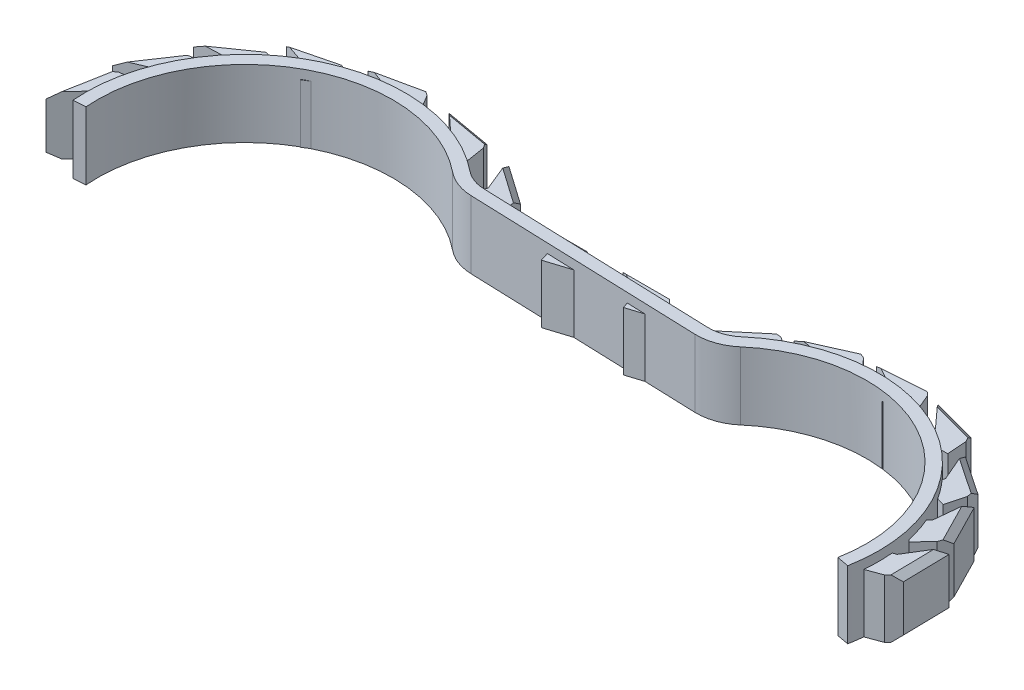
from build123d import *
from OCP.BRepFilletAPI import BRepFilletAPI_MakeChamfer

# Parameters (mm, degrees)
EXTRUDE_2_DEPTH   = 11
EXTRUDE_3_DEPTH   = 9.5
CHAMFER_1_SIZE    = 1
CHAMFER_1_SIZE2   = 1.61712281
CHAMFER_1_SIZE2_2 = 1.617122809
CHAMFER_1_SIZE2_3 = 1.617122811
CHAMFER_1_SIZE2_4 = 0.723405284


# Read off the part's stored shape, not the designer's step: 凸台-拉伸3
with BuildPart() as part:
    # 草图2 → 凸台-拉伸2 (new body)
    with BuildSketch(Plane(origin=(0, 0, 0), x_dir=(1, 0, 0), z_dir=(0, 1, 0))):
        with BuildLine():
            Line((-19.132296049, 16.866454117), (18.555519142, 15.54984922))
            ThreePointArc((18.555519142, 15.54984922), (21.477472764, 15.994050776), (24.038740937, 17.468850199))
            ThreePointArc((24.038740937, 17.468850199), (50.512289767, 19.91148373), (61.603868982, -4.250306699))
            Line((61.603868982, -4.250306699), (63.569422807, -4.619898586))
            ThreePointArc((63.569422807, -4.619898586), (51.513358442, 21.642917098), (22.737761888, 18.987880651))
            ThreePointArc((22.737761888, 18.987880651), (20.816810758, 17.881781084), (18.625345542, 17.548629916))
            Line((18.625345542, 17.548629916), (-19.062469649, 18.865234814))
            ThreePointArc((-19.062469649, 18.865234814), (-20.955262867, 19.241928278), (-22.63055474, 20.200031235))
            ThreePointArc((-22.63055474, 20.200031235), (-51.116752852, 23.00400618), (-64.9171999, -2.073342558))
            Line((-64.9171999, -2.073342558), (-62.923569138, -1.913854668))
            ThreePointArc((-62.923569138, -1.913854668), (-50.184694941, 21.234467243), (-23.889742837, 18.646182678))
            ThreePointArc((-23.889742837, 18.646182678), (-21.65602034, 17.36871207), (-19.132296049, 16.866454117))
        make_face()
    extrude(amount=EXTRUDE_2_DEPTH)

    # 凸台-拉伸3 outline → 凸台-拉伸3 (add)
    with BuildSketch(Plane(origin=(0, 0, 0), x_dir=(1, 0, 0), z_dir=(0, 1, 0))):
        Polygon((1.509952661, 20.901115598), (6.026508067, 17.988763977), (11.160061895, 17.809425851), (10.091240619, 20.901115598), align=None)
        Polygon((-11.808829957, 20.901115598), (-8.055183791, 18.48070081), (-2.321539759, 18.280398835), (-3.227541999, 20.901115598), align=None)
        with BuildLine():
            Line((-20.309179364, 20.842254555), (-20.827615105, 19.195815043))
            ThreePointArc((-20.827615105, 19.195815043), (-19.957480483, 18.964111197), (-19.062469649, 18.865234814))
            Line((-19.062469649, 18.865234814), (-16.410904709, 18.772603724))
            Line((-16.410904709, 18.772603724), (-15.601854188, 21.616913619))
            Line((-15.601854188, 21.616913619), (-22.635627666, 26.53265707))
            Line((-22.635627666, 26.53265707), (-20.309179364, 20.842254555))
        make_face()
        with BuildLine():
            Line((-30.523410649, 24.995562107), (-30.465831271, 24.559478091))
            ThreePointArc((-30.465831271, 24.559478091), (-28.454718543, 23.765458948), (-26.516534249, 22.80708405))
            Line((-26.516534249, 22.80708405), (-25.81581444, 22.899605236))
            Line((-25.81581444, 22.899605236), (-26.584510252, 27.687043232))
            Line((-26.584510252, 27.687043232), (-35.03675688, 29.16961868))
            Line((-35.03675688, 29.16961868), (-30.523410649, 24.995562107))
        make_face()
        with BuildLine():
            Line((-41.793508963, 26.321666613), (-41.540883568, 25.875546578))
            ThreePointArc((-41.540883568, 25.875546578), (-39.284746718, 25.998440709), (-37.026459417, 25.924990599))
            Line((-37.026459417, 25.924990599), (-36.643542501, 26.141825822))
            Line((-36.643542501, 26.141825822), (-39.149670686, 30.292702517))
            Line((-39.149670686, 30.292702517), (-47.541839832, 28.50105522))
            Line((-47.541839832, 28.50105522), (-41.793508963, 26.321666613))
        make_face()
        with BuildLine():
            Line((-52.189835936, 23.12143196), (-51.866030655, 22.593478156))
            ThreePointArc((-51.866030655, 22.593478156), (-49.917761837, 23.596662401), (-47.891936049, 24.43222203))
            Line((-47.891936049, 24.43222203), (-49.686195367, 27.182317441))
            Line((-49.686195367, 27.182317441), (-58.010724642, 25.098879088))
            Line((-58.010724642, 25.098879088), (-52.189835936, 23.12143196))
        make_face()
        with BuildLine():
            Line((-58.959787889, 17.986467336), (-58.268464034, 17.456411252))
            ThreePointArc((-58.268464034, 17.456411252), (-56.713457183, 19.032431128), (-55.030004578, 20.470440963))
            Line((-55.030004578, 20.470440963), (-58.077729263, 22.674855072))
            Line((-58.077729263, 22.674855072), (-65.102709323, 17.746553319))
            Line((-65.102709323, 17.746553319), (-58.959787889, 17.986467336))
        make_face()
        with BuildLine():
            Line((-63.407040272, 10.936733793), (-62.685647299, 10.723344256))
            ThreePointArc((-62.685647299, 10.723344256), (-61.674250421, 12.723143001), (-60.494402691, 14.628419359))
            Line((-60.494402691, 14.628419359), (-64.263735503, 15.629822357))
            Line((-64.263735503, 15.629822357), (-69.05597399, 8.511328604))
            Line((-69.05597399, 8.511328604), (-63.407040272, 10.936733793))
        make_face()
        with BuildLine():
            Line((-63.887137271, 7.525317167), (-68.217697297, 6.866685493))
            Line((-68.217697297, 6.866685493), (-69.770152334, -1.573005638))
            Line((-69.770152334, -1.573005638), (-65.558897097, 2.905651728))
            Line((-65.558897097, 2.905651728), (-64.826788776, 2.99616113))
            ThreePointArc((-64.826788776, 2.99616113), (-64.457884582, 5.281677066), (-63.887137271, 7.525317167))
        make_face()
        with BuildLine():
            ThreePointArc((23.160852709, 19.342218412), (25.089391993, 20.772457363), (27.146239325, 22.011096244))
            Line((27.146239325, 22.011096244), (23.021620513, 24.477494022))
            Line((23.021620513, 24.477494022), (16.452902423, 18.95567859))
            Line((16.452902423, 18.95567859), (22.551538301, 19.730070542))
            Line((22.551538301, 19.730070542), (23.160852709, 19.342218412))
        make_face()
        with BuildLine():
            ThreePointArc((31.500549491, 23.848652836), (33.693739523, 24.430382719), (35.930640341, 24.810865186))
            Line((35.930640341, 24.810865186), (36.25860383, 25.101244014))
            Line((36.25860383, 25.101244014), (32.944224768, 28.640360746))
            Line((32.944224768, 28.640360746), (25.107949071, 25.143035164))
            Line((25.107949071, 25.143035164), (31.183785489, 24.206416618))
            Line((31.183785489, 24.206416618), (31.500549491, 23.848652836))
        make_face()
        with BuildLine():
            ThreePointArc((40.920211914, 24.926146638), (43.138890272, 24.655011404), (45.324483678, 24.186791979))
            Line((45.324483678, 24.186791979), (45.851728195, 24.394709543))
            Line((45.851728195, 24.394709543), (43.947679859, 28.853975822))
            Line((43.947679859, 28.853975822), (35.387833615, 28.247728917))
            Line((35.387833615, 28.247728917), (40.776909853, 25.289536938))
            Line((40.776909853, 25.289536938), (40.920211914, 24.926146638))
        make_face()
        with BuildLine():
            ThreePointArc((49.954548309, 22.472157692), (51.492067719, 21.655212862), (52.968998307, 20.733236272))
            Line((52.968998307, 20.733236272), (54.425289614, 20.797371264))
            Line((54.425289614, 20.797371264), (54.076771637, 25.633587868))
            Line((54.076771637, 25.633587868), (45.785903323, 27.847183501))
            Line((45.785903323, 27.847183501), (49.918281908, 23.295646431))
            Line((49.918281908, 23.295646431), (49.954548309, 22.472157692))
        make_face()
        with BuildLine():
            ThreePointArc((57.639521218, 16.66037961), (58.857493933, 15.188151129), (59.959469836, 13.627201628))
            Line((59.959469836, 13.627201628), (61.213454471, 13.256270373))
            Line((61.213454471, 13.256270373), (62.458442363, 17.942469362))
            Line((62.458442363, 17.942469362), (55.33994861, 22.734707848))
            Line((55.33994861, 22.734707848), (57.7653538, 17.085774131))
            Line((57.7653538, 17.085774131), (57.639521218, 16.66037961))
        make_face()
        with BuildLine():
            ThreePointArc((62.026011142, 9.736673503), (62.792944972, 7.674357926), (63.375575489, 5.552595752))
            Line((63.375575489, 5.552595752), (63.700399481, 5.222302472))
            Line((63.700399481, 5.222302472), (67.061204779, 8.717362352))
            Line((67.061204779, 8.717362352), (63.158553178, 16.359862826))
            Line((63.158553178, 16.359862826), (62.541202944, 10.243334304))
            Line((62.541202944, 10.243334304), (62.026011142, 9.736673503))
        make_face()
        with BuildLine():
            Line((67.721327754, 7.712051308), (64.485147416, 2.485180418))
            Line((64.485147416, 2.485180418), (63.89512565, 2.287513687))
            ThreePointArc((63.89512565, 2.287513687), (63.999991439, -0.020689822), (63.89130529, -2.328716596))
            Line((63.89130529, -2.328716596), (67.87875608, -0.867792475))
            Line((67.87875608, -0.867792475), (67.721327754, 7.712051308))
        make_face()
        with BuildLine():
            Line((32.969747867, 22.189291407), (32.979707703, 22.198109845))
            ThreePointArc((32.979707703, 22.198109845), (32.972545507, 22.196166163), (32.965383939, 22.194220171))
            Line((32.965383939, 22.194220171), (32.969747867, 22.189291407))
        make_face()
        with BuildLine():
            Line((41.765268067, 22.783224154), (41.86174794, 22.821270752))
            ThreePointArc((41.86174794, 22.821270752), (41.803178905, 22.828538894), (41.744591413, 22.835656723))
            Line((41.744591413, 22.835656723), (41.765268067, 22.783224154))
        make_face()
        with BuildLine():
            Line((61.941943413, 1.633166388), (61.930542774, 1.629346991))
            Line((61.930542774, 1.629346991), (61.945301076, 1.585294462))
            ThreePointArc((61.945301076, 1.585294462), (61.94363473, 1.609231301), (61.941943413, 1.633166388))
        make_face()
        Polygon((-5.833384373, 14.999714699), (-1.823432409, 16.261777658), (-6.279592447, 16.417451371), align=None)
        Polygon((7.485398244, 14.999714699), (10.164699231, 15.842978299), (7.187258581, 15.946993694), align=None)
        with BuildLine():
            Line((-50.781276456, 20.824822301), (-49.745719627, 21.459951298))
            ThreePointArc((-49.745719627, 21.459951298), (-50.286383316, 21.180593752), (-50.819790058, 20.887617456))
            Line((-50.819790058, 20.887617456), (-50.781276456, 20.824822301))
        make_face()
    extrude(amount=EXTRUDE_3_DEPTH)

    # 倒角1: one chamfer whose edges measure the first distance from different faces: ONE call of the kernel's chamfer builder (chamfer() names one face for all edges)
    chamfer_1_edges_1 = [part.edges().sort_by_distance(p)[0] for p in [
        (-30.810633566, 0, -28.428330956),
        (-30.810633566, 9.5, -28.428330956),
        (67.800041917, 0, -3.422129417),
        (67.800041917, 9.5, -3.422129417),
        (65.109878978, 0, -12.538612589),
        (65.109878978, 9.5, -12.538612589),
        (58.899195487, 0, -20.338588605),
        (58.899195487, 9.5, -20.338588605),
        (49.93133748, 0, -26.740385684),
        (49.93133748, 9.5, -26.740385684),
        (39.667756737, 9.5, -28.550852369),
        (39.667756737, 0, -28.550852369),
        (29.026086919, 9.5, -26.891697955),
        (29.026086919, 0, -26.891697955),
        (19.737261468, 0, -21.716586306),
        (19.737261468, 9.5, -21.716586306),
        (5.80059664, 9.5, -20.901115598),
        (5.80059664, 0, -20.901115598),
        (-7.518185978, 9.5, -20.901115598),
        (-7.518185978, 0, -20.901115598),
        (-19.118740927, 9.5, -24.074785345),
        (-19.118740927, 0, -24.074785345),
        (-53.848460004, 9.5, -26.140598264),
        (-53.848460004, 0, -26.140598264),
        (-68.993924816, 0, -2.646839928),
        (-68.993924816, 9.5, -2.646839928),
        (-66.659854747, 0, -12.070575481),
        (-66.659854747, 9.5, -12.070575481),
        (-61.590219293, 0, -20.210704195),
        (-61.590219293, 9.5, -20.210704195),
        (-43.345755259, 0, -29.396878868),
        (-43.345755259, 9.5, -29.396878868),
    ]]
    chamfer_1_edges_2 = [part.edges().sort_by_distance(p)[0] for p in [
        (-26.584510252, 4.75, -27.687043232),
    ]]
    chamfer_1_side_2 = [part.faces().sort_by_distance(p)[0] for p in [
        (-30.810633566, 4.75, -28.428330956),
    ]]
    chamfer_1_edges_3 = [part.edges().sort_by_distance(p)[0] for p in [
        (67.87875608, 4.75, 0.867792475),
    ]]
    chamfer_1_side_3 = [part.faces().sort_by_distance(p)[0] for p in [
        (67.800041917, 4.75, -3.422129417),
    ]]
    chamfer_1_edges_4 = [part.edges().sort_by_distance(p)[0] for p in [
        (67.061204779, 4.75, -8.717362352),
    ]]
    chamfer_1_side_4 = [part.faces().sort_by_distance(p)[0] for p in [
        (65.109878978, 4.75, -12.538612589),
    ]]
    chamfer_1_edges_5 = [part.edges().sort_by_distance(p)[0] for p in [
        (62.458442363, 4.75, -17.942469362),
    ]]
    chamfer_1_side_5 = [part.faces().sort_by_distance(p)[0] for p in [
        (58.899195486, 4.75, -20.338588605),
    ]]
    chamfer_1_edges_6 = [part.edges().sort_by_distance(p)[0] for p in [
        (54.076771637, 4.75, -25.633587868),
    ]]
    chamfer_1_side_6 = [part.faces().sort_by_distance(p)[0] for p in [
        (49.93133748, 4.75, -26.740385685),
    ]]
    chamfer_1_edges_7 = [part.edges().sort_by_distance(p)[0] for p in [
        (43.947679859, 4.75, -28.853975822),
    ]]
    chamfer_1_side_7 = [part.faces().sort_by_distance(p)[0] for p in [
        (39.667756737, 4.75, -28.550852369),
    ]]
    chamfer_1_edges_8 = [part.edges().sort_by_distance(p)[0] for p in [
        (32.944224768, 4.75, -28.640360746),
    ]]
    chamfer_1_side_8 = [part.faces().sort_by_distance(p)[0] for p in [
        (29.026086919, 4.75, -26.891697955),
    ]]
    chamfer_1_edges_9 = [part.edges().sort_by_distance(p)[0] for p in [
        (23.021620513, 4.75, -24.477494022),
    ]]
    chamfer_1_side_9 = [part.faces().sort_by_distance(p)[0] for p in [
        (19.737261468, 4.75, -21.716586306),
    ]]
    chamfer_1_edges_10 = [part.edges().sort_by_distance(p)[0] for p in [
        (10.091240619, 4.75, -20.901115598),
    ]]
    chamfer_1_side_10 = [part.faces().sort_by_distance(p)[0] for p in [
        (5.80059664, 4.75, -20.901115598),
    ]]
    chamfer_1_edges_11 = [part.edges().sort_by_distance(p)[0] for p in [
        (-3.227541999, 4.75, -20.901115598),
    ]]
    chamfer_1_side_11 = [part.faces().sort_by_distance(p)[0] for p in [
        (-7.518185978, 4.75, -20.901115598),
    ]]
    chamfer_1_edges_12 = [part.edges().sort_by_distance(p)[0] for p in [
        (-15.601854188, 4.75, -21.616913619),
    ]]
    chamfer_1_side_12 = [part.faces().sort_by_distance(p)[0] for p in [
        (-19.118740927, 4.75, -24.074785345),
    ]]
    chamfer_1_edges_13 = [part.edges().sort_by_distance(p)[0] for p in [
        (-49.686195367, 4.75, -27.182317441),
    ]]
    chamfer_1_side_13 = [part.faces().sort_by_distance(p)[0] for p in [
        (-53.848460005, 4.75, -26.140598264),
    ]]
    chamfer_1_edges_14 = [part.edges().sort_by_distance(p)[0] for p in [
        (-58.010724642, 4.75, -25.098879088),
    ]]
    chamfer_1_side_14 = [part.faces().sort_by_distance(p)[0] for p in [
        (-55.100280289, 4.75, -24.110155524),
    ]]
    chamfer_1_edges_15 = [part.edges().sort_by_distance(p)[0] for p in [
        (-68.217697297, 4.75, -6.866685493),
    ]]
    chamfer_1_side_15 = [part.faces().sort_by_distance(p)[0] for p in [
        (-68.993924816, 4.75, -2.646839927),
    ]]
    chamfer_1_edges_16 = [part.edges().sort_by_distance(p)[0] for p in [
        (-64.263735503, 4.75, -15.629822357),
    ]]
    chamfer_1_side_16 = [part.faces().sort_by_distance(p)[0] for p in [
        (-66.659854747, 4.75, -12.07057548),
    ]]
    chamfer_1_edges_17 = [part.edges().sort_by_distance(p)[0] for p in [
        (-58.077729263, 4.75, -22.674855072),
    ]]
    chamfer_1_side_17 = [part.faces().sort_by_distance(p)[0] for p in [
        (-61.590219293, 4.75, -20.210704195),
    ]]
    chamfer_1_edges_18 = [part.edges().sort_by_distance(p)[0] for p in [
        (-39.149670686, 4.75, -30.292702517),
    ]]
    chamfer_1_side_18 = [part.faces().sort_by_distance(p)[0] for p in [
        (-43.345755259, 4.75, -29.396878868),
    ]]
    chamfer_1 = BRepFilletAPI_MakeChamfer(part.part.solid().wrapped)
    for e in chamfer_1_edges_1:
        chamfer_1.Add(CHAMFER_1_SIZE, e.wrapped)
    for e in chamfer_1_edges_2:
        chamfer_1.Add(CHAMFER_1_SIZE, CHAMFER_1_SIZE2, e.wrapped, chamfer_1_side_2[0].wrapped)  # the first distance lies on this face
    for e in chamfer_1_edges_3:
        chamfer_1.Add(CHAMFER_1_SIZE, CHAMFER_1_SIZE2, e.wrapped, chamfer_1_side_3[0].wrapped)  # the first distance lies on this face
    for e in chamfer_1_edges_4:
        chamfer_1.Add(CHAMFER_1_SIZE, CHAMFER_1_SIZE2, e.wrapped, chamfer_1_side_4[0].wrapped)  # the first distance lies on this face
    for e in chamfer_1_edges_5:
        chamfer_1.Add(CHAMFER_1_SIZE, CHAMFER_1_SIZE2, e.wrapped, chamfer_1_side_5[0].wrapped)  # the first distance lies on this face
    for e in chamfer_1_edges_6:
        chamfer_1.Add(CHAMFER_1_SIZE, CHAMFER_1_SIZE2_2, e.wrapped, chamfer_1_side_6[0].wrapped)  # the first distance lies on this face
    for e in chamfer_1_edges_7:
        chamfer_1.Add(CHAMFER_1_SIZE, CHAMFER_1_SIZE2, e.wrapped, chamfer_1_side_7[0].wrapped)  # the first distance lies on this face
    for e in chamfer_1_edges_8:
        chamfer_1.Add(CHAMFER_1_SIZE, CHAMFER_1_SIZE2_2, e.wrapped, chamfer_1_side_8[0].wrapped)  # the first distance lies on this face
    for e in chamfer_1_edges_9:
        chamfer_1.Add(CHAMFER_1_SIZE, CHAMFER_1_SIZE2, e.wrapped, chamfer_1_side_9[0].wrapped)  # the first distance lies on this face
    for e in chamfer_1_edges_10:
        chamfer_1.Add(CHAMFER_1_SIZE, CHAMFER_1_SIZE2_2, e.wrapped, chamfer_1_side_10[0].wrapped)  # the first distance lies on this face
    for e in chamfer_1_edges_11:
        chamfer_1.Add(CHAMFER_1_SIZE, CHAMFER_1_SIZE2, e.wrapped, chamfer_1_side_11[0].wrapped)  # the first distance lies on this face
    for e in chamfer_1_edges_12:
        chamfer_1.Add(CHAMFER_1_SIZE, CHAMFER_1_SIZE2, e.wrapped, chamfer_1_side_12[0].wrapped)  # the first distance lies on this face
    for e in chamfer_1_edges_13:
        chamfer_1.Add(CHAMFER_1_SIZE, CHAMFER_1_SIZE2_3, e.wrapped, chamfer_1_side_13[0].wrapped)  # the first distance lies on this face
    for e in chamfer_1_edges_14:
        chamfer_1.Add(CHAMFER_1_SIZE, CHAMFER_1_SIZE2_4, e.wrapped, chamfer_1_side_14[0].wrapped)  # the first distance lies on this face
    for e in chamfer_1_edges_15:
        chamfer_1.Add(CHAMFER_1_SIZE, CHAMFER_1_SIZE2_2, e.wrapped, chamfer_1_side_15[0].wrapped)  # the first distance lies on this face
    for e in chamfer_1_edges_16:
        chamfer_1.Add(CHAMFER_1_SIZE, CHAMFER_1_SIZE2_2, e.wrapped, chamfer_1_side_16[0].wrapped)  # the first distance lies on this face
    for e in chamfer_1_edges_17:
        chamfer_1.Add(CHAMFER_1_SIZE, CHAMFER_1_SIZE2, e.wrapped, chamfer_1_side_17[0].wrapped)  # the first distance lies on this face
    for e in chamfer_1_edges_18:
        chamfer_1.Add(CHAMFER_1_SIZE, CHAMFER_1_SIZE2, e.wrapped, chamfer_1_side_18[0].wrapped)  # the first distance lies on this face
    add(Compound.cast(chamfer_1.Shape()), mode=Mode.REPLACE)


solid = part.part
